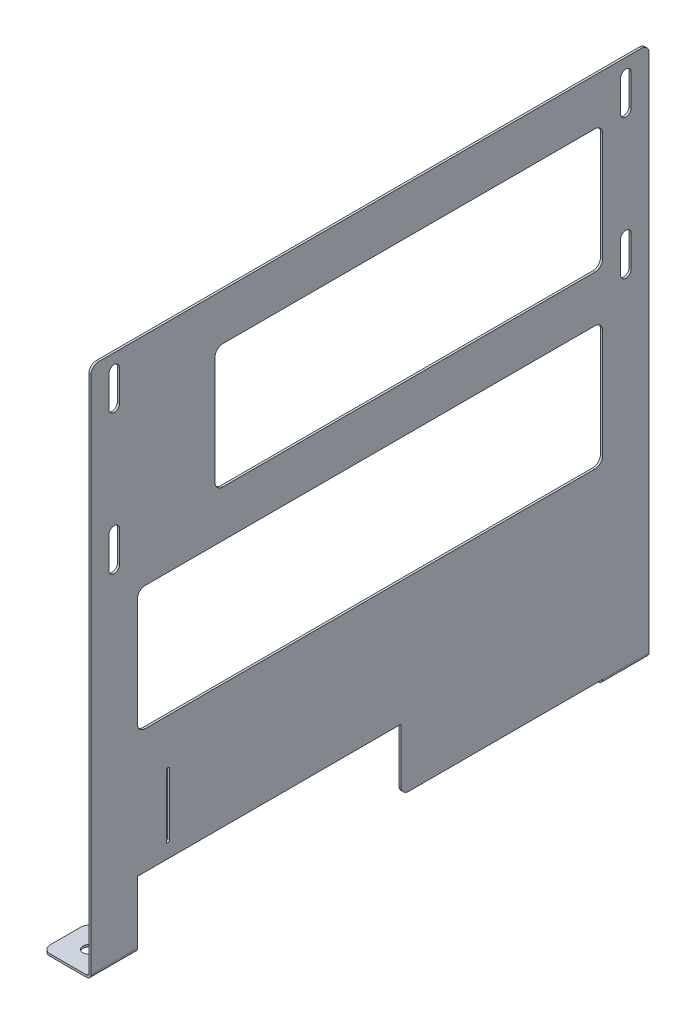
from build123d import *

# Parameters (mm, degrees)
BASE_FLANGE1_START        = -0.7
BASE_FLANGE1_OUTLINE_W    = 150
BASE_FLANGE1_OUTLINE_H    = 40
BASE_FLANGE1_OUTLINE_W_2  = 125
BASE_FLANGE1_DEPTH        = 0.7
CUT_EXTRUDE1_DEPTH        = 10
EDGE_FLANGE3_DEPTH        = 15
EDGE_FLANGE2_DEPTH        = 15
F_6_CLEARANCE_HOLE1_D     = 3.7973
F_6_CLEARANCE_HOLE1_DEPTH = 10
F_6_CLEARANCE_HOLE1_TIP   = 1.140824014
CUT_EXTRUDE2_DEPTH        = 10
BREAK_CORNER1_START       = -61.4366
BREAK_CORNER1_DEPTH       = 0.7
BREAK_CORNER1_START_2     = -0.7
BREAK_CORNER1_2_DEPTH     = 0.7
FILLET1_R                 = 2.5


# Read off the part's stored shape, not the designer's step: Base-Flange1, Break-Corner1
# Sheet-metal steps are written as plain solids
with BuildPart() as part:
    # Base-Flange1 outline → Base-Flange1 (new body)
    with BuildSketch(Plane(origin=(0, 0, 0), x_dir=(0, 0, -1), z_dir=(1, 0, 0)).offset(BASE_FLANGE1_START)):
        Polygon((180, 110), (0, 110), (0, -60), (15, -60), (15, -40), (100, -40), (100, -60), (180, -60), align=None)
        with Locations((90, 20)):
            Rectangle(BASE_FLANGE1_OUTLINE_W, BASE_FLANGE1_OUTLINE_H, mode=Mode.SUBTRACT)
        with Locations((102.5, 75)):
            Rectangle(BASE_FLANGE1_OUTLINE_W_2, BASE_FLANGE1_OUTLINE_H, mode=Mode.SUBTRACT)
    extrude(amount=BASE_FLANGE1_DEPTH)

    # Sketch4 → Cut-Extrude1 (cut)
    with BuildSketch(Plane(origin=(0, 0, 0), x_dir=(0, 0, -1), z_dir=(1, 0, 0))):
        with BuildLine():
            Line((25.3, -15), (25.3, -35))
            ThreePointArc((25.3, -35), (24.8, -35.5), (24.3, -35))
            Line((24.3, -35), (24.3, -15))
            ThreePointArc((24.3, -15), (24.8, -14.5), (25.3, -15))
        make_face()
    extrude(amount=-CUT_EXTRUDE1_DEPTH, mode=Mode.SUBTRACT)

    # Edge-Flange3 section (across the edge) → Edge-Flange3 (add)
    with BuildSketch(Plane(origin=(-0.7, -60.7366, -180), x_dir=(0, 1, 0), z_dir=(0, 0, 1))):
        with BuildLine():
            Line((-0.7, 0.7366), (-0.7, 15))
            Line((-0.7, 15), (0, 15))
            Line((0, 15), (0, 0.7366))
            ThreePointArc((0, 0.7366), (0.215745145, 0.215745145), (0.7366, 0))
            Line((0.7366, 0), (0.7366, -0.7))
            ThreePointArc((0.7366, -0.7), (-0.279229602, -0.279229602), (-0.7, 0.7366))
        make_face()
    extrude(amount=EDGE_FLANGE3_DEPTH)

    # Edge-Flange2 section (across the edge) → Edge-Flange2 (add)
    with BuildSketch(Plane(origin=(-0.7, -60.7366, -15), x_dir=(0, 1, 0), z_dir=(0, 0, 1))):
        with BuildLine():
            Line((-0.7, 0.7366), (-0.7, 15))
            Line((-0.7, 15), (0, 15))
            Line((0, 15), (0, 0.7366))
            ThreePointArc((0, 0.7366), (0.215745145, 0.215745145), (0.7366, 0))
            Line((0.7366, 0), (0.7366, -0.7))
            ThreePointArc((0.7366, -0.7), (-0.279229602, -0.279229602), (-0.7, 0.7366))
        make_face()
    extrude(amount=EDGE_FLANGE2_DEPTH)

    # #6 Clearance Hole1
    with Locations(Plane(origin=(0, -60.7366, 0), x_dir=(1, 0, 0), z_dir=(0, 1, 0))):
        with Locations((-8.2, 7.5), (-8.2, 172.5)):
            Hole(F_6_CLEARANCE_HOLE1_D / 2, depth=F_6_CLEARANCE_HOLE1_DEPTH)
            with Locations((0, 0, -(F_6_CLEARANCE_HOLE1_DEPTH + F_6_CLEARANCE_HOLE1_TIP / 2))):  # 118° drill point
                Cone(0, F_6_CLEARANCE_HOLE1_D / 2, F_6_CLEARANCE_HOLE1_TIP, mode=Mode.SUBTRACT)

    # Sketch13 → Cut-Extrude2 (cut)
    with BuildSketch(Plane(origin=(0, 0, 0), x_dir=(0, 0, -1), z_dir=(1, 0, 0))):
        with BuildLine():
            Line((9.2, 105), (9.2, 95))
            ThreePointArc((9.2, 95), (7.5, 93.3), (5.8, 95))
            Line((5.8, 95), (5.8, 105))
            ThreePointArc((5.8, 105), (7.5, 106.7), (9.2, 105))
        make_face()
        with BuildLine():
            Line((174.2, 105), (174.2, 95))
            ThreePointArc((174.2, 95), (172.5, 93.3), (170.8, 95))
            Line((170.8, 95), (170.8, 105))
            ThreePointArc((170.8, 105), (172.5, 106.7), (174.2, 105))
        make_face()
        with BuildLine():
            Line((9.2, 60), (9.2, 50))
            ThreePointArc((9.2, 50), (7.5, 48.3), (5.8, 50))
            Line((5.8, 50), (5.8, 60))
            ThreePointArc((5.8, 60), (7.5, 61.7), (9.2, 60))
        make_face()
        with BuildLine():
            Line((174.2, 60), (174.2, 50))
            ThreePointArc((174.2, 50), (172.5, 48.3), (170.8, 50))
            Line((170.8, 50), (170.8, 60))
            ThreePointArc((170.8, 60), (172.5, 61.7), (174.2, 60))
        make_face()
    extrude(amount=-CUT_EXTRUDE2_DEPTH, mode=Mode.SUBTRACT)

    # Break-Corner1 outline → Break-Corner1 (cut)
    with BuildSketch(Plane(origin=(0, 0, 0), x_dir=(1, 0, 0), z_dir=(0, 1, 0)).offset(BREAK_CORNER1_START)):
        with BuildLine():
            ThreePointArc((-13.2, 0), (-14.967766953, 0.732233047), (-15.7, 2.5))
            Line((-15.7, 2.5), (-15.7, 0))
            Line((-15.7, 0), (-13.2, 0))
        make_face()
        with BuildLine():
            ThreePointArc((-15.7, 12.5), (-14.967766953, 14.267766953), (-13.2, 15))
            Line((-13.2, 15), (-15.7, 15))
            Line((-15.7, 15), (-15.7, 12.5))
        make_face()
        with BuildLine():
            Line((-15.7, 180), (-15.7, 177.5))
            ThreePointArc((-15.7, 177.5), (-14.967766953, 179.267766953), (-13.2, 180))
            Line((-13.2, 180), (-15.7, 180))
        make_face()
        with BuildLine():
            ThreePointArc((-13.2, 165), (-14.967766953, 165.732233047), (-15.7, 167.5))
            Line((-15.7, 167.5), (-15.7, 165))
            Line((-15.7, 165), (-13.2, 165))
        make_face()
    extrude(amount=BREAK_CORNER1_DEPTH, mode=Mode.SUBTRACT)

    # Break-Corner1 2 outline → Break-Corner1 2 (cut)
    with BuildSketch(Plane.YZ.offset(BREAK_CORNER1_START_2)):
        with BuildLine():
            ThreePointArc((107.5, 0), (109.267766953, -0.732233047), (110, -2.5))
            Line((110, -2.5), (110, 0))
            Line((110, 0), (107.5, 0))
        make_face()
        with BuildLine():
            ThreePointArc((110, -177.5), (109.267766953, -179.267766953), (107.5, -180))
            Line((107.5, -180), (110, -180))
            Line((110, -180), (110, -177.5))
        make_face()
        with BuildLine():
            ThreePointArc((-60, -102.5), (-59.267766953, -100.732233047), (-57.5, -100))
            Line((-57.5, -100), (-60, -100))
            Line((-60, -100), (-60, -102.5))
        make_face()
    extrude(amount=BREAK_CORNER1_2_DEPTH, mode=Mode.SUBTRACT)

    # Fillet1
    fillet1_edges = [part.edges().sort_by_distance(p)[0] for p in [
        (-0.35, 55, -40),
        (-0.35, 95, -40),
        (-0.35, 95, -165),
        (-0.35, 55, -165),
        (-0.35, 40, -165),
        (-0.35, 0, -165),
        (-0.35, 0, -15),
        (-0.35, 40, -15),
    ]]
    fillet(fillet1_edges, radius=FILLET1_R)


solid = part.part
